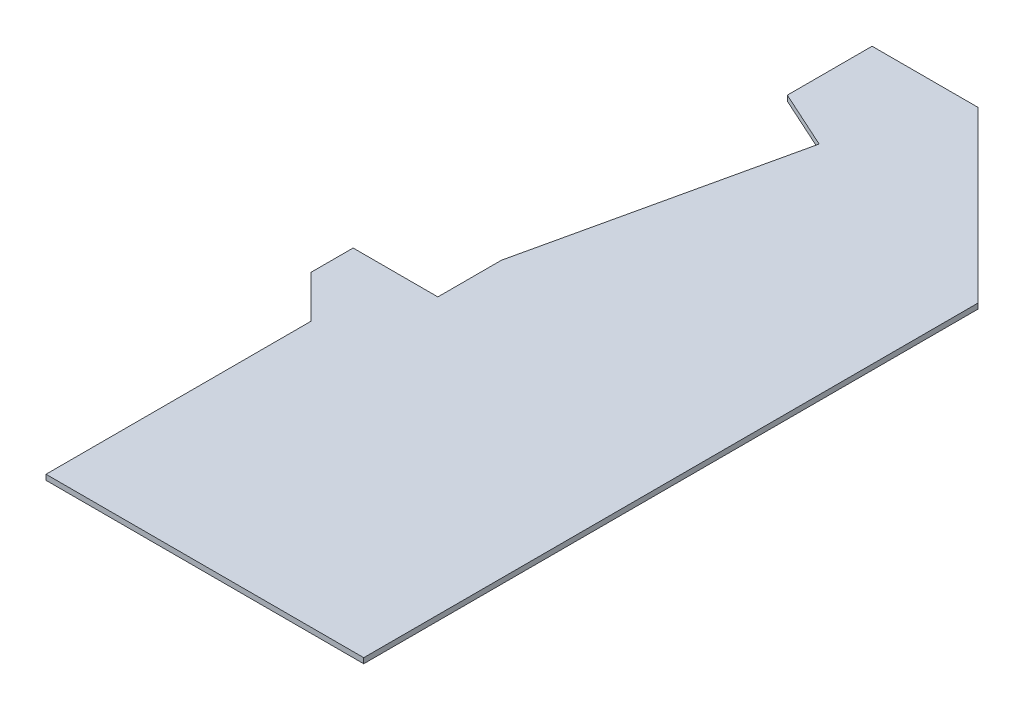
from build123d import *

# Parameters (mm, degrees)
BOSS_EXTRUDE1_DEPTH = 12.7


with BuildPart() as part:
    # Sketch1 → Boss-Extrude1 (new body)
    with BuildSketch(Plane(origin=(0, 0, 0), x_dir=(1, 0, 0), z_dir=(0, 1, 0))):
        Polygon((-108.53449825, -3.903212814), (-108.53449825, 1469.296787186), (-514.93449825, 1875.696787186), (-768.93449825, 1875.696787186), (-768.93449825, 1672.496787186), (-629.23449825, 1608.996787186), (-768.93449825, 986.696787186), (-768.93449825, 834.296787186), (-972.13449825, 834.296787186), (-972.13449825, 732.696787186), (-870.53449825, 631.096787186), (-870.53449825, -3.903212814), align=None)
    extrude(amount=BOSS_EXTRUDE1_DEPTH)


solid = part.part
